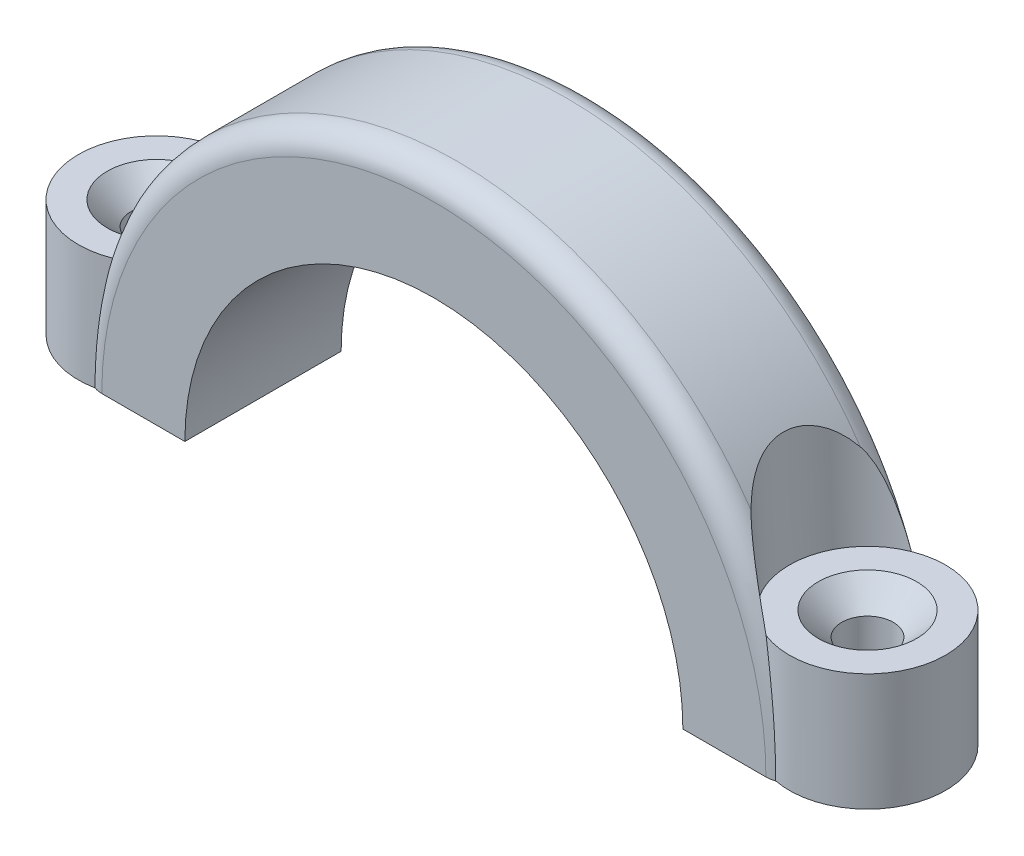
from build123d import *

# Parameters (mm, degrees)
BOSS_EXTRUDE1_DEPTH                             = 10
SKETCH2_R                                       = 10
BOSS_EXTRUDE2_DEPTH                             = 15
CUT_EXTRUDE1_START                              = -15
SKETCH2_2_R                                     = 10
CUT_EXTRUDE1_DEPTH                              = 45
CUT_EXTRUDE1_DRAFT                              = 3
CSK_FOR_M6_FLAT_HEAD_MACHINE_SCREW1_D           = 6.6
CSK_FOR_M6_FLAT_HEAD_MACHINE_SCREW1_CSINK_D     = 12.6
CSK_FOR_M6_FLAT_HEAD_MACHINE_SCREW1_CSINK_ANGLE = 90
MIRROR1_START                                   = -15
MIRROR1_COPY_1_SKETCH_R                         = 10
MIRROR1_COPY_1_DEPTH                            = 45
MIRROR1_COPY_1_DRAFT                            = 3
FILLET1_R                                       = 3


with BuildPart() as part:
    # Sketch1 → Boss-Extrude1 (new, symmetric)
    with BuildSketch(Plane.XY):
        with BuildLine():
            Line((-45.5, 0), (-31.87, 0))
            ThreePointArc((-31.87, 0), (0, 31.87), (31.87, 0))
            Line((31.87, 0), (45.5, 0))
            ThreePointArc((45.5, 0), (0, 45.5), (-45.5, 0))
        make_face()
    extrude(amount=BOSS_EXTRUDE1_DEPTH, both=True)

    # Sketch2 → Boss-Extrude2 (add)
    with BuildSketch(Plane.XZ):
        with Locations((-45.5, 0)):
            Circle(SKETCH2_R)
    boss_extrude2 = extrude(amount=-BOSS_EXTRUDE2_DEPTH)


with BuildPart() as cut_extrude1_tool:
    # Sketch2<2> → Cut-Extrude1 (with draft: the straight prism first)
    with BuildSketch(Plane.XZ.offset(CUT_EXTRUDE1_START)):
        with Locations((-45.5, 0)):
            Circle(SKETCH2_2_R)
    extrude(amount=-CUT_EXTRUDE1_DEPTH)
    # Cut-Extrude1: the draft: its side faces are tilted about the plane it starts from
    cut_extrude1_sides = [cut_extrude1_tool.faces().sort_by_distance(p)[0] for p in [
        (-55.5, 37.5, 0),
    ]]
    draft(cut_extrude1_sides, Plane.XZ.offset(CUT_EXTRUDE1_START), CUT_EXTRUDE1_DRAFT)


with BuildPart() as part_1:
    add(part.part)

    # Cut-Extrude1: cut by cut_extrude1_tool
    add(cut_extrude1_tool.part, mode=Mode.SUBTRACT)

    # CSK for M6 Flat Head Machine Screw1 (through all)
    with Locations(Plane(origin=(0, 15, 0), x_dir=(1, 0, 0), z_dir=(0, 1, 0))):
        with Locations((-45.5, 0)):
            csk_for_m6_flat_head_machine_screw1 = CounterSinkHole(CSK_FOR_M6_FLAT_HEAD_MACHINE_SCREW1_D / 2, CSK_FOR_M6_FLAT_HEAD_MACHINE_SCREW1_CSINK_D / 2, counter_sink_angle=CSK_FOR_M6_FLAT_HEAD_MACHINE_SCREW1_CSINK_ANGLE)

    # Mirror1: Boss-Extrude2, CSK for M6 Flat Head Machine Screw1 across plane
    add(boss_extrude2.mirror(Plane(origin=(0, 0, 0), x_dir=(0, 0, 1), z_dir=(1, 0, 0))))
    add(csk_for_m6_flat_head_machine_screw1.mirror(Plane(origin=(0, 0, 0), x_dir=(0, 0, 1), z_dir=(1, 0, 0))), mode=Mode.SUBTRACT)


with BuildPart() as mirror1_copy_1_tool:
    # Mirror1 copy 1 sketch → Mirror1 copy 1 (with draft: the straight prism first)
    with BuildSketch(Plane(origin=(0, 0, 0), x_dir=(-1, 0, 0), z_dir=(0, -1, 0)).offset(MIRROR1_START)):
        with Locations((-45.5, 0)):
            Circle(MIRROR1_COPY_1_SKETCH_R)
    extrude(amount=-MIRROR1_COPY_1_DEPTH)
    # Mirror1 copy 1: the draft: its side faces are tilted about the plane it starts from
    mirror1_copy_1_sides = [mirror1_copy_1_tool.faces().sort_by_distance(p)[0] for p in [
        (55.5, 37.5, 0),
    ]]
    draft(mirror1_copy_1_sides, Plane(origin=(0, 0, 0), x_dir=(-1, 0, 0), z_dir=(0, -1, 0)).offset(MIRROR1_START), MIRROR1_COPY_1_DRAFT)


with BuildPart() as part_2:
    add(part_1.part)

    # Mirror1 copy 1: cut by mirror1_copy_1_tool
    add(mirror1_copy_1_tool.part, mode=Mode.SUBTRACT)

    # Fillet1
    # the kernel refuses this fillet: 3 mm, written as the material it takes off along each edge
    with BuildSketch(Plane(origin=(0, 0, 10), x_dir=(0.9864018839376206, -0.1643512195400838, 0), z_dir=(-0.1643512195400838, -0.9864018839376206, 0))) as fillet1_piece_1_section:
        with BuildLine():
            CenterArc((45.5 - FILLET1_R, -FILLET1_R), FILLET1_R, 0, 90)
            Line((45.5 - FILLET1_R, 0), (45.5, 0))
            Line((45.5, 0), (45.5, -FILLET1_R))
        make_face()
    fillet1_piece_1 = revolve(axis=Axis((0, 0, 10), (0, 0, 1)), revolution_arc=198.919095152, mode=Mode.PRIVATE)
    fillet1_piece_1 = fillet1_piece_1 - Plane(origin=(-45.5, 9.787690876, 0), x_dir=(1, 0, 0), z_dir=(0, -1, 0)) * Cylinder(10, 182, mode=Mode.PRIVATE)
    fillet1_piece_1 = fillet1_piece_1 - Plane(origin=(45.5, 9.787690876, 0), x_dir=(-1, 0, 0), z_dir=(0, -1, 0)) * Cylinder(10, 182, mode=Mode.PRIVATE)
    add(fillet1_piece_1, mode=Mode.SUBTRACT)
    with BuildSketch(Plane(origin=(0, 0, -10), x_dir=(0.9864018839376206, -0.1643512195400838, 0), z_dir=(-0.1643512195400838, -0.9864018839376206, 0))) as fillet1_piece_2_section:
        with BuildLine():
            CenterArc((45.5 - FILLET1_R, FILLET1_R), FILLET1_R, 270, 90)
            Line((45.5 - FILLET1_R, 0), (45.5, 0))
            Line((45.5, 0), (45.5, FILLET1_R))
        make_face()
    fillet1_piece_2 = revolve(axis=Axis((0, 0, -10), (0, 0, 1)), revolution_arc=198.919095152, mode=Mode.PRIVATE)
    fillet1_piece_2 = fillet1_piece_2 - Plane(origin=(-45.5, 9.787689661, 0), x_dir=(1, 0, 0), z_dir=(0, -1, 0)) * Cylinder(10, 182, mode=Mode.PRIVATE)
    fillet1_piece_2 = fillet1_piece_2 - Plane(origin=(45.5, 9.787689661, 0), x_dir=(-1, 0, 0), z_dir=(0, -1, 0)) * Cylinder(10, 182, mode=Mode.PRIVATE)
    add(fillet1_piece_2, mode=Mode.SUBTRACT)


solid = part_2.part
